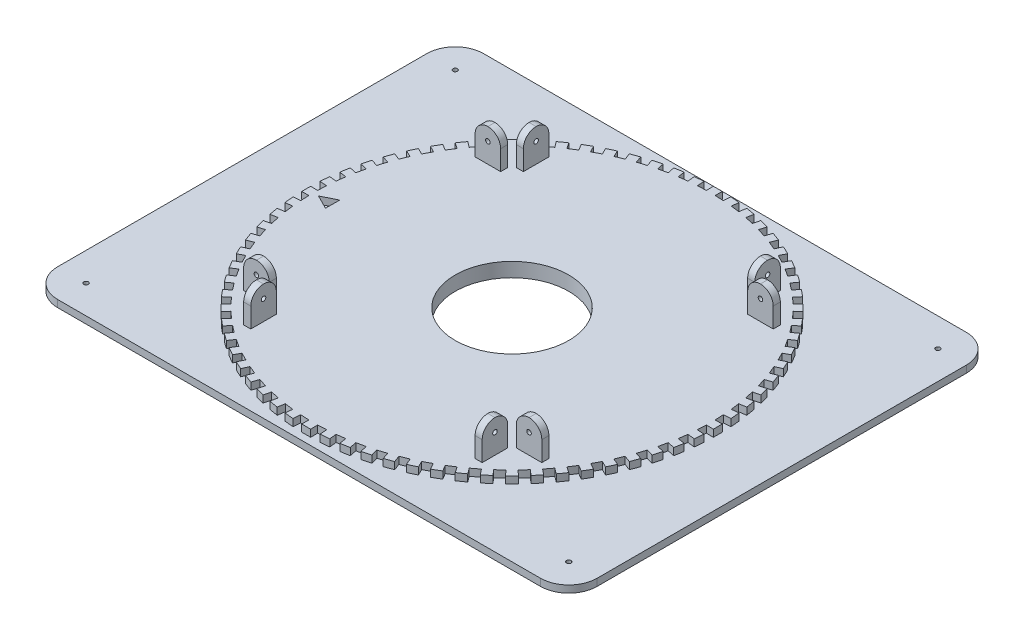
from build123d import *

# Parameters (mm, degrees)
SKETCH1_W            = 380
SKETCH1_H            = 300
SKETCH1_R            = 1.6
BOSS_EXTRUDE1_DEPTH  = 5
FILLET2_R            = 20
SKETCH3_R            = 145
BOSS_EXTRUDE2_DEPTH  = 5
CUT_EXTRUDE1_START   = -5
CUT_EXTRUDE1_DEPTH   = 5
CIRPATTERN1_COUNT    = 72
SKETCH12_W           = 18
SKETCH12_H           = 5
SKETCH12_W_2         = 5
SKETCH12_H_2         = 18
BOSS_EXTRUDE6_DEPTH  = 23
CUT_EXTRUDE5_REACH   = 305.224
SKETCH13_R           = 1.6
CUT_EXTRUDE6_REACH   = 316.11
SKETCH14_R           = 1.6
FILLET3_R            = 9
FILLET3_OF_MIRROR1_R = 9
MIRROR2_START        = 79
MIRROR2_OUTLINE_R    = 1.6
MIRROR2_DEPTH        = 5
MIRROR2_START_2      = -84
MIRROR2_2_OUTLINE_R  = 1.6
MIRROR2_2_DEPTH      = 5
MIRROR2_3_OUTLINE_R  = 1.6
MIRROR2_3_DEPTH      = 5
SKETCH15_R           = 40
CUT_EXTRUDE7_DEPTH   = 244.164553338
CUT_EXTRUDE8_DEPTH   = 5


# Read off the part's stored shape, not the designer's step: Mirror2
with BuildPart() as part:
    # Sketch1 → Boss-Extrude1 (new body)
    with BuildSketch(Plane(origin=(0, 0, 0), x_dir=(1, 0, 0), z_dir=(0, 1, 0))):
        Rectangle(SKETCH1_W, SKETCH1_H)
        with Locations(Location((-170, -130, 0), (0, 0, 270))):
            Circle(SKETCH1_R, mode=Mode.SUBTRACT)
        with Locations(Location((-170, 130, 0), (0, 0, 90))):
            Circle(SKETCH1_R, mode=Mode.SUBTRACT)
        with Locations(Location((170, 130, 0), (0, 0, 270))):
            Circle(SKETCH1_R, mode=Mode.SUBTRACT)
        with Locations(Location((170, -130, 0), (0, 0, 90))):
            Circle(SKETCH1_R, mode=Mode.SUBTRACT)
    extrude(amount=BOSS_EXTRUDE1_DEPTH)

    # Fillet2
    fillet2_edges = [part.edges().sort_by_distance(p)[0] for p in [
        (190, 2.5, 150),
        (-190, 2.5, 150),
        (-190, 2.5, -150),
        (190, 2.5, -150),
    ]]
    fillet(fillet2_edges, radius=FILLET2_R)

    # Sketch3 → Boss-Extrude2 (add)
    with BuildSketch(Plane(origin=(0, 5, 0), x_dir=(1, 0, 0), z_dir=(0, 1, 0))):
        with Locations(Location((0, 0, 0), (0, 0, 270))):
            Circle(SKETCH3_R)
    extrude(amount=BOSS_EXTRUDE2_DEPTH)

    # Sketch5 → Cut-Extrude1 (cut)
    with BuildSketch(Plane(origin=(0, 10, 0), x_dir=(1, 0, 0), z_dir=(0, 1, 0)).offset(CUT_EXTRUDE1_START)):
        with BuildLine():
            Line((-144.965493927, 3.16315833), (-139.966683791, 3.054083905))
            ThreePointArc((-139.966683791, 3.054083905), (-139.866751021, 6.106714231), (-139.700249253, 9.156438092))
            Line((-139.700249253, 9.156438092), (-144.68954387, 9.483453738))
            ThreePointArc((-144.68954387, 9.483453738), (-144.861992129, 6.324811168), (-144.965493927, 3.16315833))
        make_face()
    cut_extrude1 = extrude(amount=CUT_EXTRUDE1_DEPTH, mode=Mode.SUBTRACT)

    # CirPattern1: Cut-Extrude1 ×72 about axis
    cirpattern1_axis = Axis((0, 0, 0), (0, 1, 0))
    for i in range(1, CIRPATTERN1_COUNT):
        add(cut_extrude1.rotate(cirpattern1_axis, i * 360 / CIRPATTERN1_COUNT), mode=Mode.SUBTRACT)

    # Sketch12 → Boss-Extrude6 (add)
    with BuildSketch(Plane(origin=(0, 10, 0), x_dir=(1, 0, 0), z_dir=(0, 1, 0))):
        with Locations((-96, -81.5)):
            Rectangle(SKETCH12_W, SKETCH12_H)
        with Locations((-81.5, -96)):
            Rectangle(SKETCH12_W_2, SKETCH12_H_2)
    boss_extrude6 = extrude(amount=BOSS_EXTRUDE6_DEPTH)

    # Sketch13 → Cut-Extrude5 (cut, up to next)
    with BuildSketch(Plane.XY.offset(84), mode=Mode.PRIVATE) as cut_extrude5_sk1:
        with Locations((-96, 24)):
            Circle(SKETCH13_R)
    cut_extrude5_tool1 = extrude(cut_extrude5_sk1.sketch, amount=-CUT_EXTRUDE5_REACH, mode=Mode.PRIVATE) & part.part
    cut_extrude5 = cut_extrude5_tool1.solids().sort_by_distance((-96, 24, 84))[0]
    add(cut_extrude5, mode=Mode.SUBTRACT)

    # Sketch14 → Cut-Extrude6 (cut, up to next)
    with BuildSketch(Plane.ZY.offset(84), mode=Mode.PRIVATE) as cut_extrude6_sk1:
        with Locations((96, 24)):
            Circle(SKETCH14_R)
    cut_extrude6_tool1 = extrude(cut_extrude6_sk1.sketch, amount=-CUT_EXTRUDE6_REACH, mode=Mode.PRIVATE) & part.part
    cut_extrude6 = cut_extrude6_tool1.solids().sort_by_distance((-84, 24, 96))[0]
    add(cut_extrude6, mode=Mode.SUBTRACT)

    # Fillet3
    fillet3_edges = [part.edges().sort_by_distance(p)[0] for p in [
        (-105, 33, 81.5),
        (-87, 33, 81.5),
        (-81.5, 33, 87),
        (-81.5, 33, 105),
    ]]
    fillet(fillet3_edges, radius=FILLET3_R - 0.0001)  # a hair under: the kernel refuses the full size

    # Mirror1: Boss-Extrude6, Cut-Extrude5, Cut-Extrude6 across plane
    add(boss_extrude6.mirror(Plane.XY))
    add(cut_extrude5.mirror(Plane.XY), mode=Mode.SUBTRACT)
    add(cut_extrude6.mirror(Plane.XY), mode=Mode.SUBTRACT)

    # Fillet3 of Mirror1
    fillet3_of_mirror1_edges = [part.edges().sort_by_distance(p)[0] for p in [
        (-105, 33, -81.5),
        (-87, 33, -81.5),
        (-81.5, 33, -87),
        (-81.5, 33, -105),
    ]]
    fillet(fillet3_of_mirror1_edges, radius=FILLET3_OF_MIRROR1_R - 0.0001)  # a hair under: the kernel refuses the full size

    # Mirror2 outline → Mirror2 (add)
    # profile 1 of 2: a face of its own
    with BuildSketch(Plane.YZ.offset(MIRROR2_START)):
        with BuildLine():
            Line((24, -87), (10, -87))
            Line((10, -87), (10, -105))
            Line((10, -105), (24, -105))
            ThreePointArc((24, -105), (30.363961031, -102.363961031), (33, -96))
            ThreePointArc((33, -96), (30.363961031, -89.636038969), (24, -87))
        make_face()
        with Locations((24, -96)):
            Circle(MIRROR2_OUTLINE_R, mode=Mode.SUBTRACT)
    # profile 2 of 2: a face of its own
    with BuildSketch(Plane.YZ.offset(MIRROR2_START)):
        with BuildLine():
            Line((10, 87), (24, 87))
            ThreePointArc((24, 87), (30.363961031, 89.636038969), (33, 96))
            ThreePointArc((33, 96), (30.363961031, 102.363961031), (24, 105))
            Line((24, 105), (10, 105))
            Line((10, 105), (10, 87))
        make_face()
        with Locations((24, 96)):
            Circle(MIRROR2_OUTLINE_R, mode=Mode.SUBTRACT)
    extrude(amount=MIRROR2_DEPTH)

    # Mirror2 2 outline → Mirror2 2 (add)
    with BuildSketch(Plane.XY.offset(MIRROR2_START_2)):
        with BuildLine():
            ThreePointArc((96, 33), (89.636038969, 30.363961031), (87, 24))
            Line((87, 24), (87, 10))
            Line((87, 10), (105, 10))
            Line((105, 10), (105, 24))
            ThreePointArc((105, 24), (102.363961031, 30.363961031), (96, 33))
        make_face()
        with Locations((96, 24)):
            Circle(MIRROR2_2_OUTLINE_R, mode=Mode.SUBTRACT)
    extrude(amount=MIRROR2_2_DEPTH)

    # Mirror2 3 outline → Mirror2 3 (add)
    with BuildSketch(Plane.XY.offset(MIRROR2_START)):
        with BuildLine():
            ThreePointArc((96, 33), (89.636038969, 30.363961031), (87, 24))
            Line((87, 24), (87, 10))
            Line((87, 10), (105, 10))
            Line((105, 10), (105, 24))
            ThreePointArc((105, 24), (102.363961031, 30.363961031), (96, 33))
        make_face()
        with Locations((96, 24)):
            Circle(MIRROR2_3_OUTLINE_R, mode=Mode.SUBTRACT)
    extrude(amount=MIRROR2_3_DEPTH)

    # Sketch15 → Cut-Extrude7 (cut, through all)
    with BuildSketch(Plane(origin=(0, 10, 0), x_dir=(1, 0, 0), z_dir=(0, 1, 0))):
        with Locations(Location((0, 0, 0), (0, 0, 270))):
            Circle(SKETCH15_R)
    extrude(amount=-CUT_EXTRUDE7_DEPTH, mode=Mode.SUBTRACT)

    # Sketch16 → Cut-Extrude8 (cut)
    with BuildSketch(Plane(origin=(0, 10, 0), x_dir=(1, 0, 0), z_dir=(0, 1, 0))):
        Polygon((-136.349443121, 0), (-126.349443121, 5), (-126.349443121, -5), align=None)
    extrude(amount=-CUT_EXTRUDE8_DEPTH, mode=Mode.SUBTRACT)


solid = part.part
